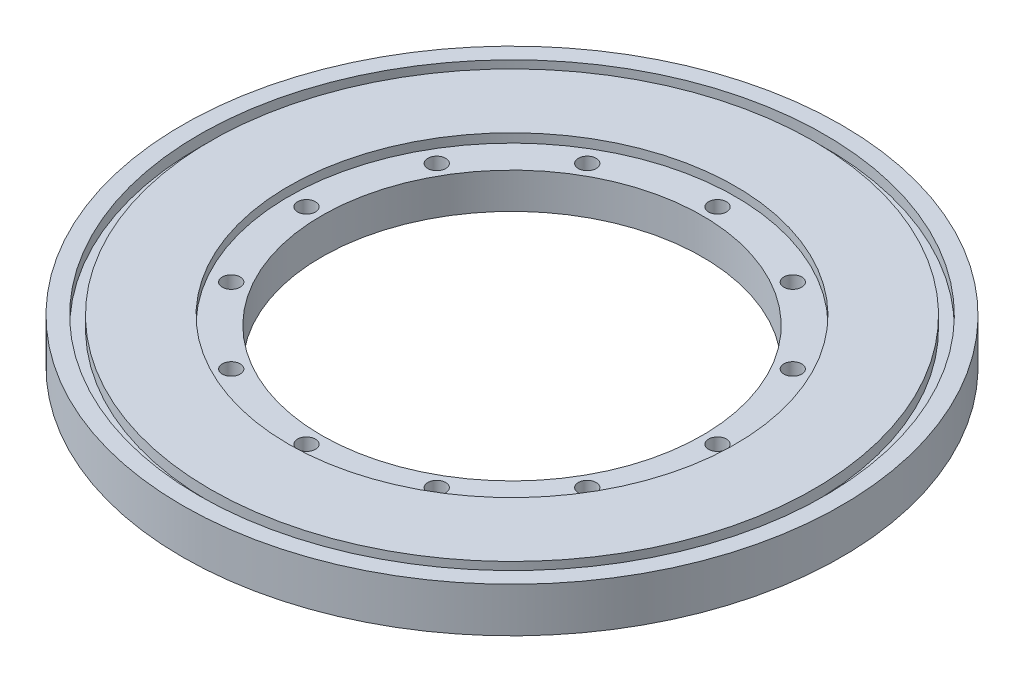
from build123d import *

# Parameters (mm, degrees)
SKETCH1_R           = 93.6625
BOSS_EXTRUDE1_DEPTH = 12.7
SKETCH2_R           = 54.102
CUT_EXTRUDE1_DEPTH  = 134.066215895
SKETCH3_R           = 63.5
CUT_EXTRUDE2_DEPTH  = 2.54
SKETCH4_R           = 2.54
CUT_EXTRUDE3_DEPTH  = 134.066215895
CIRPATTERN1_COUNT   = 12
SKETCH5_R           = 88.9
SKETCH5_R_2         = 85.725
CUT_EXTRUDE4_DEPTH  = 3.175


with BuildPart() as part:
    # Sketch1 → Boss-Extrude1 (new body)
    with BuildSketch(Plane(origin=(0, 0, 0), x_dir=(1, 0, 0), z_dir=(0, 1, 0))):
        Circle(SKETCH1_R)
    extrude(amount=BOSS_EXTRUDE1_DEPTH)

    # Sketch2 → Cut-Extrude1 (cut, through all)
    with BuildSketch(Plane(origin=(0, 12.7, 0), x_dir=(1, 0, 0), z_dir=(0, 1, 0))):
        Circle(SKETCH2_R)
    extrude(amount=-CUT_EXTRUDE1_DEPTH, mode=Mode.SUBTRACT)

    # Sketch3 → Cut-Extrude2 (cut)
    with BuildSketch(Plane(origin=(0, 12.7, 0), x_dir=(1, 0, 0), z_dir=(0, 1, 0))):
        Circle(SKETCH3_R)
    extrude(amount=-CUT_EXTRUDE2_DEPTH, mode=Mode.SUBTRACT)

    # Sketch4 → Cut-Extrude3 (cut, through all)
    with BuildSketch(Plane(origin=(0, 12.7, 0), x_dir=(1, 0, 0), z_dir=(0, 1, 0))):
        with Locations((0, 58.42)):
            Circle(SKETCH4_R)
    cut_extrude3 = extrude(amount=-CUT_EXTRUDE3_DEPTH, mode=Mode.SUBTRACT)

    # CirPattern1: Cut-Extrude3 ×12 about axis
    cirpattern1_axis = Axis((0, 12.7, 0), (0, 1, 0))
    for i in range(1, CIRPATTERN1_COUNT):
        add(cut_extrude3.rotate(cirpattern1_axis, i * 360 / CIRPATTERN1_COUNT), mode=Mode.SUBTRACT)

    # Sketch5 → Cut-Extrude4 (cut)
    with BuildSketch(Plane(origin=(0, 12.7, 0), x_dir=(1, 0, 0), z_dir=(0, 1, 0))):
        Circle(SKETCH5_R)
        Circle(SKETCH5_R_2, mode=Mode.SUBTRACT)
    extrude(amount=-CUT_EXTRUDE4_DEPTH, mode=Mode.SUBTRACT)


solid = part.part
